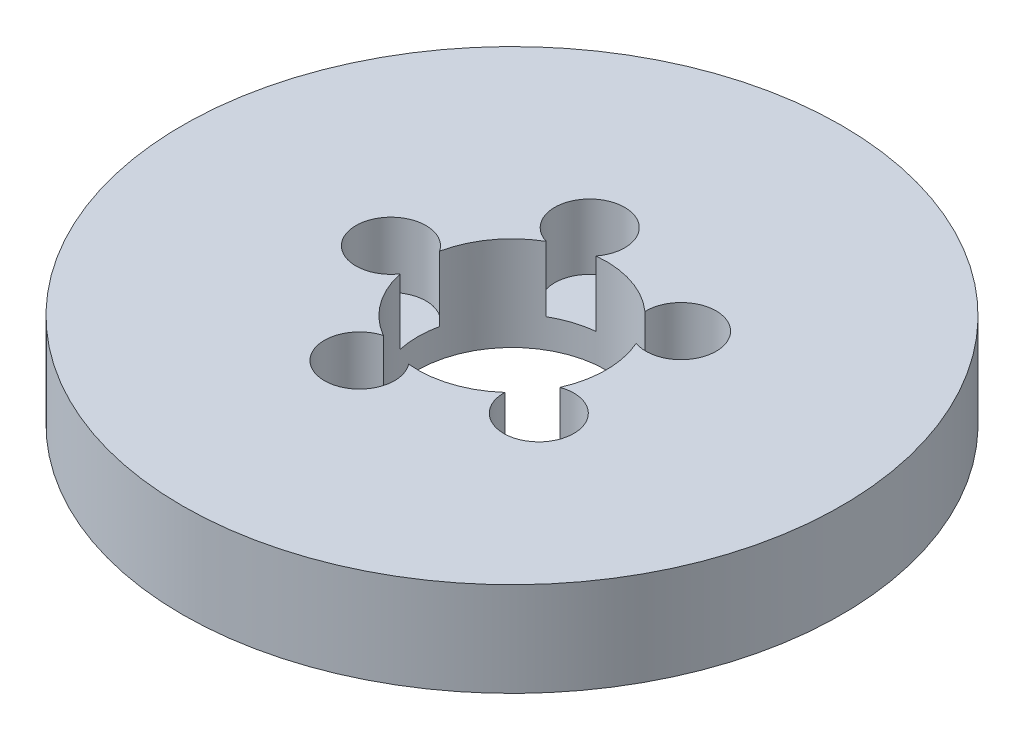
from build123d import *

# Parameters (mm, degrees)
SKETCH1_R           = 35
BOSS_EXTRUDE1_DEPTH = 10
SKETCH2_R           = 10
CUT_EXTRUDE1_DEPTH  = 51.497524692
SKETCH3_R           = 3.723043441
CUT_EXTRUDE2_DEPTH  = 6.932893731
CIRPATTERN1_COUNT   = 5


with BuildPart() as part:
    # Sketch1 → Boss-Extrude1 (new body)
    with BuildSketch(Plane(origin=(0, 0, 0), x_dir=(1, 0, 0), z_dir=(0, 1, 0))):
        Circle(SKETCH1_R)
    extrude(amount=BOSS_EXTRUDE1_DEPTH)

    # Sketch2 → Cut-Extrude1 (cut, through all)
    with BuildSketch(Plane(origin=(0, 0, 0), x_dir=(1, 0, 0), z_dir=(0, 1, 0))):
        Circle(SKETCH2_R)
    extrude(amount=CUT_EXTRUDE1_DEPTH, mode=Mode.SUBTRACT)

    # Sketch3 → Cut-Extrude2 (cut)
    with BuildSketch(Plane(origin=(0, 10, 0), x_dir=(1, 0, 0), z_dir=(0, 1, 0))):
        with Locations((-12.855153021, 0)):
            Circle(SKETCH3_R)
    cut_extrude2 = extrude(amount=-CUT_EXTRUDE2_DEPTH, mode=Mode.SUBTRACT)

    # CirPattern1: Cut-Extrude2 ×5 about axis
    cirpattern1_axis = Axis((0, 0, 0), (0, 1, 0))
    for i in range(1, CIRPATTERN1_COUNT):
        add(cut_extrude2.rotate(cirpattern1_axis, i * 360 / CIRPATTERN1_COUNT), mode=Mode.SUBTRACT)


solid = part.part
